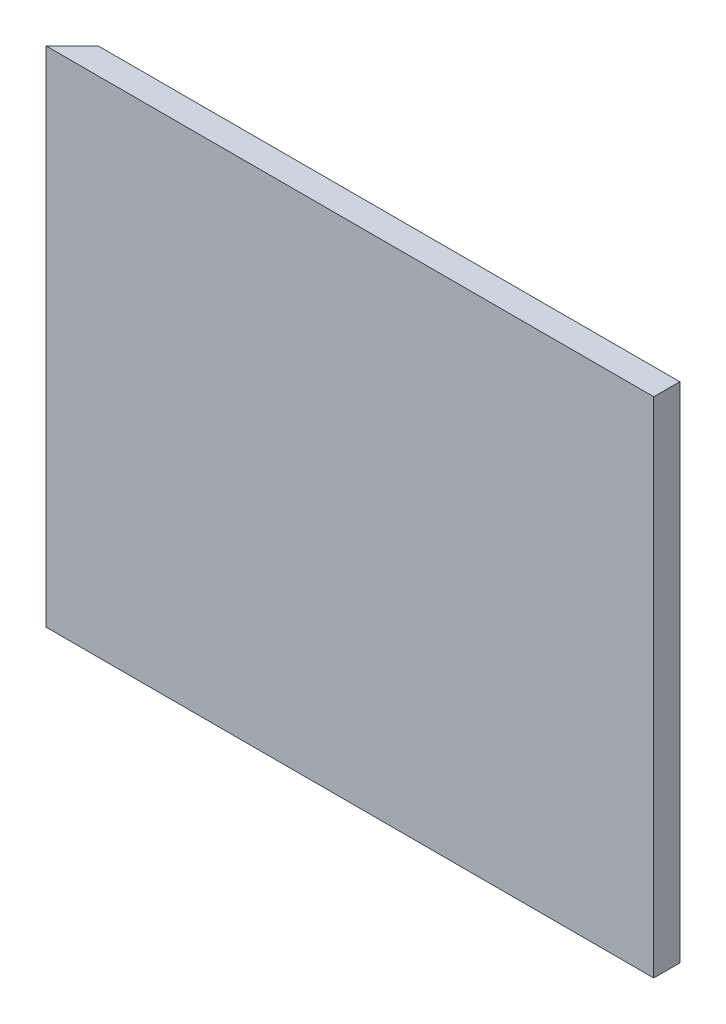
from build123d import *

# Parameters (mm, degrees)
SKETCH1_W           = 70
SKETCH1_H           = 58
BOSS_EXTRUDE1_DEPTH = 3
CHAMFER1_SIZE       = 3


with BuildPart() as part:
    # Sketch1 → Boss-Extrude1 (new body)
    with BuildSketch(Plane.XY):
        with Locations((-125.379084176, 81.977207271)):
            Rectangle(SKETCH1_W, SKETCH1_H)
    extrude(amount=BOSS_EXTRUDE1_DEPTH)

    # Chamfer1
    chamfer1_edges = [part.edges().sort_by_distance(p)[0] for p in [
        (-160.379084176, 81.977207271, 0),
    ]]
    chamfer(chamfer1_edges, length=CHAMFER1_SIZE - 0.0001)  # a hair under: the kernel refuses the full size


solid = part.part
